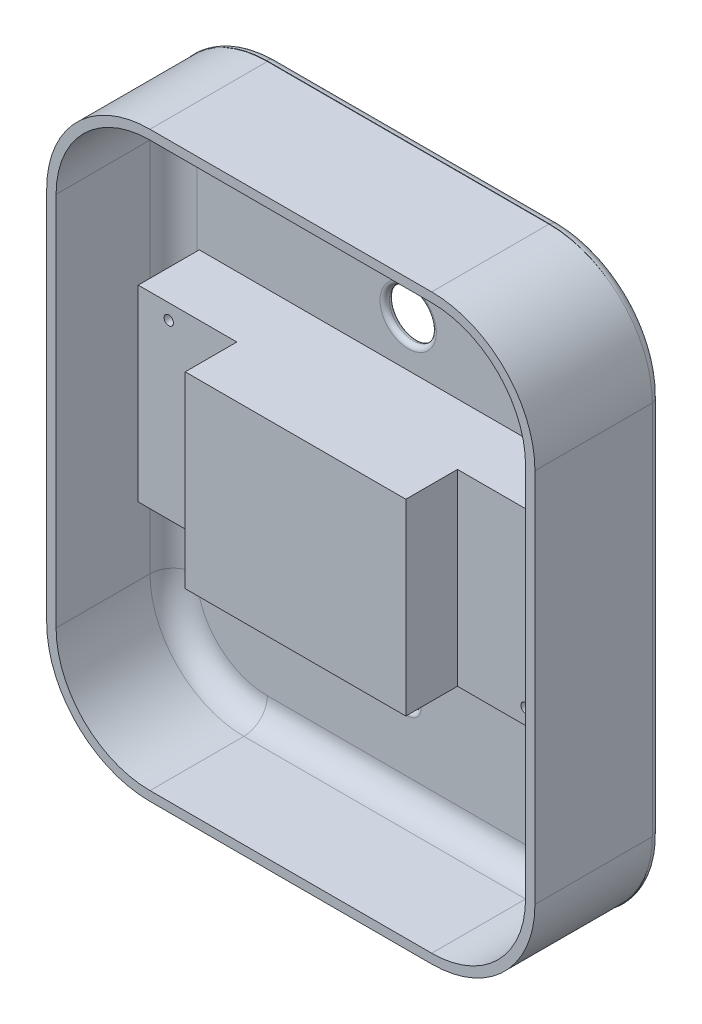
from build123d import *

# Parameters (mm, degrees)
BOSS_EXTRUDE7_DEPTH  = 25
CASE_BOTTOM_R        = 1.75
CASE_BOTTOM_R_2      = 5
BOSS_EXTRUDE9_DEPTH  = 2
FILLET1_R            = 5
FILLET2_R            = 2
FILLET3_R            = 1
SONOFF_W             = 89
SONOFF_H             = 40
SONOFF_R             = 1
BOSS_EXTRUDE10_DEPTH = 13
SKETCH2_W            = 47
SKETCH2_H            = 40
BOSS_EXTRUDE11_DEPTH = 24


# Some blends are built 0.0001 mm under size
with BuildPart() as part:
    # Case Sides → Boss-Extrude7 (new body)
    with BuildSketch(Plane.XY):
        with BuildLine():
            Line((-30, 62), (30, 62))
            ThreePointArc((30, 62), (45.556349186, 55.556349186), (52, 40))
            Line((52, 40), (52, -40))
            ThreePointArc((52, -40), (45.556349186, -55.556349186), (30, -62))
            Line((30, -62), (-30, -62))
            ThreePointArc((-30, -62), (-45.556349186, -55.556349186), (-52, -40))
            Line((-52, -40), (-52, 40))
            ThreePointArc((-52, 40), (-45.556349186, 55.556349186), (-30, 62))
        make_face()
        with BuildLine():
            Line((-30, 60), (30, 60))
            ThreePointArc((30, 60), (44.142135624, 54.142135624), (50, 40))
            Line((50, 40), (50, -40))
            ThreePointArc((50, -40), (44.142135624, -54.142135624), (30, -60))
            Line((30, -60), (-30, -60))
            ThreePointArc((-30, -60), (-44.142135624, -54.142135624), (-50, -40))
            Line((-50, -40), (-50, 40))
            ThreePointArc((-50, 40), (-44.142135624, 54.142135624), (-30, 60))
        make_face(mode=Mode.SUBTRACT)
    extrude(amount=BOSS_EXTRUDE7_DEPTH)

    # Case Bottom → Boss-Extrude9 (add)
    with BuildSketch(Plane.XY):
        with BuildLine():
            Line((-30.166381545, 62.101220113), (30.166381545, 62.101220113))
            ThreePointArc((30.166381545, 62.101220113), (45.607883681, 55.461776572), (51.813647258, 39.840934815))
            Line((51.813647258, 39.840934815), (51.813647258, -39.840934815))
            ThreePointArc((51.813647258, -39.840934815), (45.787828122, -55.499068587), (30.267855704, -61.872302115))
            Line((30.267855704, -61.872302115), (-30.267855704, -61.872302115))
            ThreePointArc((-30.267855704, -61.872302115), (-45.835002173, -55.567695757), (-52.186199447, -40.019499601))
            Line((-52.186199447, -40.019499601), (-52.186199447, 40.019499601))
            ThreePointArc((-52.186199447, 40.019499601), (-45.654372223, 55.52588799), (-30.166381545, 62.101220113))
        make_face()
        with Locations((0, 41)):
            Circle(CASE_BOTTOM_R, mode=Mode.SUBTRACT)
        with Locations((0, -41)):
            Circle(CASE_BOTTOM_R, mode=Mode.SUBTRACT)
        with Locations((0, 30)):
            Circle(CASE_BOTTOM_R_2, mode=Mode.SUBTRACT)
        with Locations((0, -30)):
            Circle(CASE_BOTTOM_R_2, mode=Mode.SUBTRACT)
    extrude(amount=-BOSS_EXTRUDE9_DEPTH)

    # Fillet1
    fillet1_edges = [part.edges().sort_by_distance(p)[0] for p in [
        (44.142135624, 54.142135624, 0),
        (0, 60, 0),
        (-44.142135624, 54.142135624, 0),
        (-50, 0, 0),
        (-44.142135624, -54.142135624, 0),
        (0, -60, 0),
        (44.142135624, -54.142135624, 0),
        (50, 0, 0),
    ]]
    fillet(fillet1_edges, radius=FILLET1_R)

    # Fillet2
    # the kernel refuses this fillet: 2 mm, written as the material it adds along each edge
    with BuildSketch(Plane(origin=(51.813647258, 39.840934815, 0.036995851), x_dir=(0.014804575706989804, 0.9998904062636744, 0), z_dir=(0, 0, -1))) as fillet2_piece_1:
        with BuildLine():
            CenterArc((0.014812433, 1.999999896), FILLET2_R, 269.151729306, 0.829764856)
            Line((-0.014796719, 0.000219083), (0, 0))
            ThreePointArc((0, 0), (0.007083229, 1.144e-06), (0.014166457, 0))
        make_face()
    extrude(amount=2.036995851)
    with BuildSketch(Plane(origin=(51.813647258, -39.840934815, 0.096592655), x_dir=(0, 1, 0), z_dir=(0, 0, -1))) as fillet2_piece_2:
        with BuildLine():
            CenterArc((0.038637062, 2), FILLET2_R, 267.835326297, 2.164673703)
            ThreePointArc((-0.03690633, 0.00142721), (-0.018452854, 0.000721643), (0, 0))
            Line((0, 0), (0.038637062, 0))
        make_face()
    extrude(amount=2.096592655)
    with BuildSketch(Plane(origin=(30.267855704, -61.872302115, 0.042125301), x_dir=(0.9998579024887219, -0.016857485899548712, 0), z_dir=(0, 0, -1))) as fillet2_piece_3:
        with BuildLine():
            CenterArc((0.016867246, 1.999999856), FILLET2_R, 269.034091453, 0.944139309)
            Line((-0.016847726, 0.000284051), (0, 0))
            ThreePointArc((0, 0), (0.008053678, 1.53e-06), (0.016107356, 0))
        make_face()
    extrude(amount=2.042125301)
    with BuildSketch(Plane(origin=(-30.267855704, -61.872302115, 0.034939961), x_dir=(-0.9999022450245147, -0.013982145576956704, 0), z_dir=(0, 0, -1))) as fillet2_piece_4:
        with BuildLine():
            CenterArc((0.013989673, -1.999999904), FILLET2_R, 90.017724864, 0.783419172)
            Line((-0.013974618, -0.000195414), (0, 0))
            ThreePointArc((0, 0), (0.006685479, -1.034e-06), (0.013370958, 0))
        make_face()
    extrude(amount=2.034939961)
    with BuildSketch(Plane(origin=(-52.186199447, -40.019499601, 0), x_dir=(0, 1, 0), z_dir=(0, 0, -1))) as fillet2_piece_5:
        with BuildLine():
            CenterArc((0.011047407, -2), FILLET2_R, 90, 0.619262575)
            ThreePointArc((-0.010568514, -0.000116815), (-0.00528425, -5.9054e-05), (0, 0))
            Line((0, 0), (0.011047407, 0))
        make_face()
    extrude(amount=2)
    # the kernel refuses this fillet: 2 mm, written as the material it takes off along each edge
    with BuildSketch(Plane(origin=(-52.186199447, 40.019499601, 0.035818212), x_dir=(0, -1, 0), z_dir=(0, 0, -1))) as fillet2_2_piece_1:
        with BuildLine():
            CenterArc((0.013672232, -2), FILLET2_R, 90, 0.802114876)
            ThreePointArc((-0.014325944, -0.000195984), (-0.007162988, -9.6846e-05), (0, 0))
            Line((0, 0), (0.013672232, 0))
        make_face()
    extrude(amount=2.071636423, mode=Mode.SUBTRACT)
    with BuildSketch(Plane(origin=(-30.166381545, 62.101220113, 0.043345147), x_dir=(1, 0, 0), z_dir=(0, 0, -1))) as fillet2_2_piece_2:
        with BuildLine():
            CenterArc((0.016545352, 2), FILLET2_R, 269.029333404, 0.970666596)
            ThreePointArc((-0.017335683, 0.000287002), (-0.008667869, 0.000141822), (0, 0))
            Line((0, 0), (0.016545352, 0))
        make_face()
    extrude(amount=2.086690294, mode=Mode.SUBTRACT)
    with BuildSketch(Plane(origin=(30.166381545, 62.101220113, 0.034352007), x_dir=(0.9999141102581969, -0.013106185812745422, 0), z_dir=(0, 0, -1))) as fillet2_2_piece_3:
        with BuildLine():
            CenterArc((0.013114237, 1.999999902), FILLET2_R, 269.249049368, 0.768900433)
            Line((-0.013098135, 0.000171681), (0, 0))
            ThreePointArc((0, 0), (0.006870401, -1.076e-06), (0.013740803, 0))
        make_face()
    extrude(amount=2.068704014, mode=Mode.SUBTRACT)
    # the kernel refuses this fillet: 2 mm, written as the material it takes off along each edge
    with BuildSketch(Plane(origin=(-29.804526261, 39.720474564, -2), x_dir=(-0.9999020079624725, 0.013999088278010021, 0), z_dir=(-0.013999088278010021, -0.9999020079624725, 0))) as fillet2_3_piece_1:
        with BuildLine():
            CenterArc((22.383670624 - FILLET2_R, -FILLET2_R), FILLET2_R, 0, 90)
            Line((22.383670624, -FILLET2_R), (22.383670624, 0))
            Line((22.383670624, 0), (22.383670624 - FILLET2_R, 0))
        make_face()
    revolve(axis=Axis((-29.804526261, 39.720474564, -2), (0, 0, -1)), revolution_arc=88.227218528, mode=Mode.SUBTRACT)
    with BuildSketch(Plane(origin=(-30.149836193, 62.101220113, -2), x_dir=(0, -1, 0), z_dir=(1, 0, 0))) as fillet2_3_piece_2:
        with BuildLine():
            CenterArc((FILLET2_R, -FILLET2_R), FILLET2_R, 90, 90)
            Line((0, -FILLET2_R), (0, 0))
            Line((0, 0), (FILLET2_R, 0))
        make_face()
    extrude(amount=60.303118478, mode=Mode.SUBTRACT)
    with BuildSketch(Plane(origin=(29.885828413, 40.172686456, -2), x_dir=(0.013419441370281596, 0.9999099552426256, 0), z_dir=(-0.9999099552426256, 0.013419441370281596, 0))) as fillet2_3_piece_3:
        with BuildLine():
            CenterArc((21.930328279 - FILLET2_R, -FILLET2_R), FILLET2_R, 0, 90)
            Line((21.930328279, -FILLET2_R), (21.930328279, 0))
            Line((21.930328279, 0), (21.930328279 - FILLET2_R, 0))
        make_face()
    revolve(axis=Axis((29.885828413, 40.172686456, -2), (0, 0, -1)), revolution_arc=90.060864423, mode=Mode.SUBTRACT)
    with BuildSketch(Plane(origin=(51.813647258, 39.826136474, -2), x_dir=(-1, 0, 0), z_dir=(0, -1, 0))) as fillet2_3_piece_4:
        with BuildLine():
            CenterArc((FILLET2_R, -FILLET2_R), FILLET2_R, 90, 90)
            Line((0, -FILLET2_R), (0, 0))
            Line((0, 0), (FILLET2_R, 0))
        make_face()
    extrude(amount=79.628434227, mode=Mode.SUBTRACT)
    with BuildSketch(Plane(origin=(30.63323575, -40.678486464, -2), x_dir=(0.999286394870838, 0.03777169609699212, 0), z_dir=(-0.03777169609699212, 0.999286394870838, 0))) as fillet2_3_piece_5:
        with BuildLine():
            CenterArc((21.196964981 - FILLET2_R, -FILLET2_R), FILLET2_R, 0, 90)
            Line((21.196964981, -FILLET2_R), (21.196964981, 0))
            Line((21.196964981, 0), (21.196964981 - FILLET2_R, 0))
        make_face()
    revolve(axis=Axis((30.63323575, -40.678486464, -2), (0, 0, -1)), revolution_arc=93.108813012, mode=Mode.SUBTRACT)
    with BuildSketch(Plane(origin=(30.251005584, -61.872302115, -2), x_dir=(0, 1, 0), z_dir=(-1, 0, 0))) as fillet2_3_piece_6:
        with BuildLine():
            CenterArc((FILLET2_R, -FILLET2_R), FILLET2_R, 90, 90)
            Line((0, -FILLET2_R), (0, 0))
            Line((0, 0), (FILLET2_R, 0))
        make_face()
    extrude(amount=60.504885303, mode=Mode.SUBTRACT)
    with BuildSketch(Plane(origin=(-30.576706868, -40.263637561, -2), x_dir=(0.013672817925882458, -0.9999065226559758, 0), z_dir=(0.9999065226559758, 0.013672817925882458, 0))) as fillet2_3_piece_7:
        with BuildLine():
            CenterArc((21.610871636 - FILLET2_R, -FILLET2_R), FILLET2_R, 0, 90)
            Line((21.610871636, -FILLET2_R), (21.610871636, 0))
            Line((21.610871636, 0), (21.610871636 - FILLET2_R, 0))
        make_face()
    revolve(axis=Axis((-30.576706868, -40.263637561, -2), (0, 0, -1)), revolution_arc=91.402681747, mode=Mode.SUBTRACT)
    with BuildSketch(Plane(origin=(-52.186199447, -40.008452194, -2), x_dir=(1, 0, 0), z_dir=(0, 1, 0))) as fillet2_3_piece_8:
        with BuildLine():
            CenterArc((FILLET2_R, -FILLET2_R), FILLET2_R, 90, 90)
            Line((0, -FILLET2_R), (0, 0))
            Line((0, 0), (FILLET2_R, 0))
        make_face()
    extrude(amount=80.014279563, mode=Mode.SUBTRACT)
    with BuildSketch(Plane(origin=(-54.186199447, -40.008452194, -2), x_dir=(1, 0, 0), z_dir=(0, 1, 0))) as fillet2_3_piece_9:
        with BuildLine():
            CenterArc((2 + FILLET2_R, -FILLET2_R), FILLET2_R, 90, 90)
            Line((2, -FILLET2_R), (2, 0))
            Line((2, 0), (2 + FILLET2_R, 0))
        make_face()
    revolve(axis=Axis((-54.186199447, -40.008452194, -2), (0, 0, -1)), revolution_arc=0.619262575, mode=Mode.SUBTRACT)
    with BuildSketch(Plane(origin=(-50.186199447, 40.005827368, -2), x_dir=(-0.9999020079624727, 0.013999088277994795, 0), z_dir=(0.013999088277994795, 0.9999020079624727, 0))) as fillet2_3_piece_10:
        with BuildLine():
            CenterArc((2 - FILLET2_R, FILLET2_R), FILLET2_R, 270, 90)
            Line((2, FILLET2_R), (2, 0))
            Line((2, 0), (2 - FILLET2_R, 0))
        make_face()
    revolve(axis=Axis((-50.186199447, 40.005827368, -2), (0, 0, 1)), revolution_arc=0.802114876, mode=Mode.SUBTRACT)
    with BuildSketch(Plane(origin=(-30.253879719, -63.872302115, -2), x_dir=(-0.013672817925883145, 0.999906522655976, 0), z_dir=(-0.999906522655976, -0.013672817925883145, 0))) as fillet2_3_piece_11:
        with BuildLine():
            CenterArc((2 + FILLET2_R, -FILLET2_R), FILLET2_R, 90, 90)
            Line((2, -FILLET2_R), (2, 0))
            Line((2, 0), (2 + FILLET2_R, 0))
        make_face()
    revolve(axis=Axis((-30.253879719, -63.872302115, -2), (0, 0, -1)), revolution_arc=0.783419172, mode=Mode.SUBTRACT)
    with BuildSketch(Plane(origin=(30.251005584, -63.872302115, -2), x_dir=(0.016477593803021027, 0.9998642352351956, 0), z_dir=(0.9998642352351956, -0.016477593803021027, 0))) as fillet2_3_piece_12:
        with BuildLine():
            CenterArc((2 + FILLET2_R, FILLET2_R), FILLET2_R, 180, 90)
            Line((2, FILLET2_R), (2, 0))
            Line((2, 0), (2 + FILLET2_R, 0))
        make_face()
    revolve(axis=Axis((30.251005584, -63.872302115, -2), (0, 0, 1)), revolution_arc=0.944139309, mode=Mode.SUBTRACT)
    with BuildSketch(Plane(origin=(53.813647258, -39.802297753, -2), x_dir=(-1, 0, 0), z_dir=(0, 1, 0))) as fillet2_3_piece_13:
        with BuildLine():
            CenterArc((2 + FILLET2_R, FILLET2_R), FILLET2_R, 180, 90)
            Line((2, FILLET2_R), (2, 0))
            Line((2, 0), (2 + FILLET2_R, 0))
        make_face()
    revolve(axis=Axis((53.813647258, -39.802297753, -2), (0, 0, 1)), revolution_arc=2.164673703, mode=Mode.SUBTRACT)
    with BuildSketch(Plane(origin=(53.813647258, 39.826136474, -2), x_dir=(-0.9998951358062248, 0.014481622528268918, 0), z_dir=(0.014481622528268918, 0.9998951358062248, 0))) as fillet2_3_piece_14:
        with BuildLine():
            CenterArc((2 + FILLET2_R, FILLET2_R), FILLET2_R, 180, 90)
            Line((2, FILLET2_R), (2, 0))
            Line((2, 0), (2 + FILLET2_R, 0))
        make_face()
    revolve(axis=Axis((53.813647258, 39.826136474, -2), (0, 0, 1)), revolution_arc=0.829764856, mode=Mode.SUBTRACT)
    with BuildSketch(Plane(origin=(30.153282285, 60.101220113, -2), x_dir=(0.013419441370290391, 0.9999099552426255, 0), z_dir=(0.9999099552426255, -0.013419441370290391, 0))) as fillet2_3_piece_15:
        with BuildLine():
            CenterArc((2 - FILLET2_R, FILLET2_R), FILLET2_R, 270, 90)
            Line((2, FILLET2_R), (2, 0))
            Line((2, 0), (2 - FILLET2_R, 0))
        make_face()
    revolve(axis=Axis((30.153282285, 60.101220113, -2), (0, 0, 1)), revolution_arc=0.768900433, mode=Mode.SUBTRACT)
    with BuildSketch(Plane(origin=(-30.149836193, 60.101220113, -2), x_dir=(0, 1, 0), z_dir=(1, 0, 0))) as fillet2_3_piece_16:
        with BuildLine():
            CenterArc((2 - FILLET2_R, FILLET2_R), FILLET2_R, 270, 90)
            Line((2, FILLET2_R), (2, 0))
            Line((2, 0), (2 - FILLET2_R, 0))
        make_face()
    revolve(axis=Axis((-30.149836193, 60.101220113, -2), (0, 0, 1)), revolution_arc=0.970666596, mode=Mode.SUBTRACT)

    # Fillet3
    fillet3_edges = [part.edges().sort_by_distance(p)[0] for p in [
        (-5, -30, -2),
        (-5, 30, -2),
        (-1.75, -41, -2),
        (-1.75, 41, -2),
        (-1.75, 41, 0),
        (-1.75, -41, 0),
        (-5, 30, 0),
        (-5, -30, 0),
    ]]
    fillet(fillet3_edges, radius=FILLET3_R - 0.0001)  # a hair under: the kernel refuses the full size

    # Sonoff → Boss-Extrude10 (add)
    with BuildSketch(Plane.XY):
        Rectangle(SONOFF_W, SONOFF_H)
        with Locations((-38, 16.75)):
            Circle(SONOFF_R, mode=Mode.SUBTRACT)
        with Locations((38, -16.75)):
            Circle(SONOFF_R, mode=Mode.SUBTRACT)
    extrude(amount=BOSS_EXTRUDE10_DEPTH)

    # Sketch2 → Boss-Extrude11 (add)
    with BuildSketch(Plane.XY):
        Rectangle(SKETCH2_W, SKETCH2_H)
    extrude(amount=BOSS_EXTRUDE11_DEPTH)


solid = part.part
